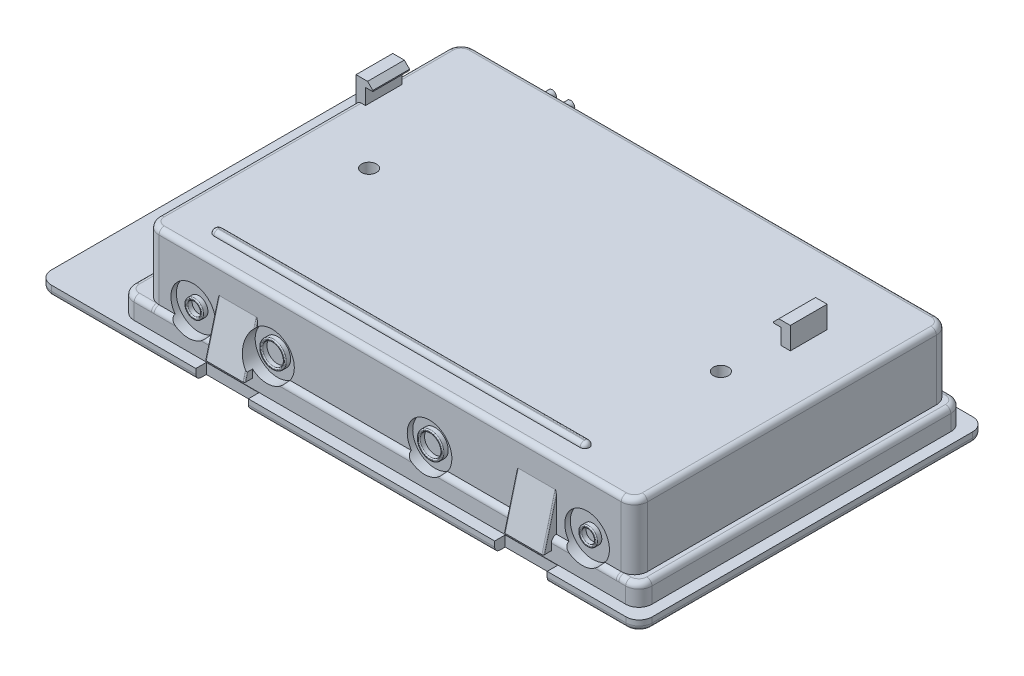
from build123d import *

# Parameters (mm, degrees)
SKETCH1_W               = 114.4
SKETCH1_H               = 66
BOSS_EXTRUDE1_DEPTH     = 2
SKETCH2_W               = 98.6
SKETCH2_H               = 61.9
BOSS_EXTRUDE2_DEPTH     = 4
SKETCH3_W               = 93
SKETCH3_H               = 60
BOSS_EXTRUDE3_DEPTH     = 12.5
FILLET1_R               = 2.5
SKETCH4_W               = 3.2
SKETCH4_H               = 7
BOSS_EXTRUDE4_DEPTH     = 4.2
LPATTERN1_COUNT         = 2
LPATTERN1_PITCH         = 79.5
FILLET2_R               = 1
CHAMFER1_SIZE           = 1
SKETCH7_W               = 1.4
SKETCH7_H               = 3
CUT_EXTRUDE1_DEPTH      = 76.074163332
BOSS_EXTRUDE5_DEPTH     = 1.25
FILLET3_R               = 1
SKETCH9_W               = 13
SKETCH9_H               = 24.5
CUT_EXTRUDE2_DEPTH      = 1
FILLET4_R               = 0.75
FILLET5_R               = 2
SKETCH10_W              = 10
SKETCH10_H              = 2
CUT_EXTRUDE3_DEPTH      = 70.829291848
BOSS_EXTRUDE7_DEPTH     = 7.5
FILLET12_R              = 0.25
LPATTERN2_COUNT         = 2
LPATTERN2_PITCH         = 56.9
FILLET12_OF_LPATTERN2_R = 0.25
SKETCH14_W              = 2.7
SKETCH14_H              = 5.65
BOSS_EXTRUDE8_DEPTH     = 2
CUT_EXTRUDE4_DEPTH      = 89.750957741
CUT_EXTRUDE4_DEPTH_BACK = 2
SKETCH11_R              = 4.25
SKETCH12_R              = 1.75
SKETCH12_R_2            = 1.25
SKETCH12_R_3            = 2.5
SKETCH12_R_4            = 2
BOSS_EXTRUDE6_DEPTH     = 1
SKETCH15_W              = 71.5
SKETCH15_H              = 1.75
BOSS_EXTRUDE9_DEPTH     = 0.8
FILLET8_RADIUS          = 0.875
FILLET8_LENGTH          = 0.8
FILLET9_RADIUS          = 0.875
FILLET9_LENGTH          = 0.8
FILLET10_R              = 0.8
CUT_EXTRUDE5_DEPTH      = 89.068893487
CUT_EXTRUDE5_DEPTH_BACK = 2
SKETCH16_R              = 4.25
SKETCH18_R              = 2.5
SKETCH18_R_2            = 2
SKETCH18_R_3            = 1.75
SKETCH18_R_4            = 1.25
BOSS_EXTRUDE10_DEPTH    = 1
FILLET11_R              = 0.2
SKETCH19_R              = 0.8
BOSS_EXTRUDE11_DEPTH    = 2.6
SKETCH20_R              = 1.425
CUT_EXTRUDE6_DEPTH      = 16.4
SKETCH21_W              = 15
SKETCH21_H              = 24.5
CUT_EXTRUDE7_DEPTH      = 0.5
FILLET13_R              = 0.25
FILLET14_R              = 0.25
BOSS_EXTRUDE12_DEPTH    = 0.5
RIB1_REACH              = 71.829
SKETCH25_WALL_W         = 147.868253574
SKETCH25_WALL_H         = 20.5


with BuildPart() as part:
    # Sketch1 → Boss-Extrude1 (new body)
    with BuildSketch(Plane(origin=(0, 0, 0), x_dir=(1, 0, 0), z_dir=(0, 1, 0))):
        Rectangle(SKETCH1_W, SKETCH1_H)
    extrude(amount=BOSS_EXTRUDE1_DEPTH)

    # Sketch2 → Boss-Extrude2 (add)
    with BuildSketch(Plane(origin=(0, 2, 0), x_dir=(1, 0, 0), z_dir=(0, 1, 0))):
        with Locations((5.8, 0)):
            Rectangle(SKETCH2_W, SKETCH2_H)
    extrude(amount=BOSS_EXTRUDE2_DEPTH)

    # Sketch3 → Boss-Extrude3 (add)
    with BuildSketch(Plane(origin=(0, 6, 0), x_dir=(1, 0, 0), z_dir=(0, 1, 0))):
        with Locations((6.8, 0)):
            Rectangle(SKETCH3_W, SKETCH3_H)
    extrude(amount=BOSS_EXTRUDE3_DEPTH)

    # Fillet1
    fillet1_edges = [part.edges().sort_by_distance(p)[0] for p in [
        (-43.5, 4, -30.95),
        (-43.5, 4, 30.95),
        (55.1, 4, 30.95),
        (55.1, 4, -30.95),
        (-39.7, 12.25, -30),
        (-39.7, 12.25, 30),
        (53.3, 12.25, 30),
        (53.3, 12.25, -30),
        (-57.2, 1, -33),
        (57.2, 1, -33),
        (57.2, 1, 33),
        (-57.2, 1, 33),
    ]]
    fillet(fillet1_edges, radius=FILLET1_R)

    # Sketch4 → Boss-Extrude4 (add)
    with BuildSketch(Plane(origin=(0, 18.5, 0), x_dir=(1, 0, 0), z_dir=(0, 1, 0))):
        with Locations((-38.1, 13.5)):
            Rectangle(SKETCH4_W, SKETCH4_H)
    boss_extrude4 = extrude(amount=BOSS_EXTRUDE4_DEPTH)

    # LPattern1: Boss-Extrude4 ×2
    with Locations(*[(i * LPATTERN1_PITCH, 0, 0) for i in range(1, LPATTERN1_COUNT)]):
        add(boss_extrude4)

    # Fillet2
    fillet2_edges = [part.edges().sort_by_distance(p)[0] for p in [
        (-42.767766953, 6, 30.217766953),
        (-43.5, 6, 0),
        (-42.767766953, 6, -30.217766953),
        (5.8, 6, -30.95),
        (54.367766953, 6, -30.217766953),
        (55.1, 6, 0),
        (54.367766953, 6, 30.217766953),
        (-38.967766953, 18.5, 29.267766953),
        (-39.7, 18.5, 8.75),
        (-39.7, 18.5, -22.25),
        (-38.967766953, 18.5, -29.267766953),
        (6.8, 18.5, -30),
        (52.567766953, 18.5, -29.267766953),
        (53.3, 18.5, 0),
        (52.567766953, 18.5, 29.267766953),
        (56.467766953, 0, -32.267766953),
        (57.2, 0, 0),
        (56.467766953, 0, 32.267766953),
        (0, 0, 33),
        (-56.467766953, 0, 32.267766953),
        (-57.2, 0, 0),
        (-56.467766953, 0, -32.267766953),
        (5.8, 6, 30.95),
        (6.8, 18.5, 30),
        (0, 0, -33),
    ]]
    fillet(fillet2_edges, radius=FILLET2_R)

    # Chamfer1
    chamfer1_edges = [part.edges().sort_by_distance(p)[0] for p in [
        (-36.5, 22.7, -13.5),
        (39.8, 22.7, -13.5),
    ]]
    chamfer(chamfer1_edges, length=CHAMFER1_SIZE)

    # Sketch7 → Cut-Extrude1 (cut, through all)
    with BuildSketch(Plane.XY.offset(-10)):
        with Locations((-37.2, 20)):
            Rectangle(SKETCH7_W, SKETCH7_H)
        with Locations((40.5, 20)):
            Rectangle(SKETCH7_W, SKETCH7_H)
    extrude(amount=-CUT_EXTRUDE1_DEPTH, mode=Mode.SUBTRACT)

    # Sketch6 → Boss-Extrude5 (add)
    with BuildSketch(Plane(origin=(0, 0, 0), x_dir=(-1, 0, 0), z_dir=(0, -1, 0))):
        with BuildLine():
            ThreePointArc((46.95, 7.6), (45.449729728, 0), (46.95, -7.6))
            Line((46.95, -7.6), (41.2, -7.6))
            Line((41.2, -7.6), (41.2, 7.6))
            Line((41.2, 7.6), (46.95, 7.6))
        make_face()
    extrude(amount=BOSS_EXTRUDE5_DEPTH)

    # Fillet3
    fillet3_edges = [part.edges().sort_by_distance(p)[0] for p in [
        (-46.95, -0.625, 7.6),
        (-46.95, -0.625, -7.6),
    ]]
    fillet(fillet3_edges, radius=FILLET3_R)

    # Sketch9 → Cut-Extrude2 (cut)
    with BuildSketch(Plane.XZ):
        with Locations((-45.1, 0)):
            Rectangle(SKETCH9_W, SKETCH9_H)
    extrude(amount=-CUT_EXTRUDE2_DEPTH, mode=Mode.SUBTRACT)


with BuildPart() as cut_extrude2_piece_1:
    # of the separate pieces the step leaves, piece 1, a body of its own (cut_extrude2_pieces)
    add(part.part.solids().sort_by_distance((54.7, 0, -32))[0])

    # Fillet4
    fillet4_edges = [cut_extrude2_piece_1.edges().sort_by_distance(p)[0] for p in [
        (-51.6, 0.5, -12.25),
        (-51.6, 0.5, 12.25),
    ]]
    fillet(fillet4_edges, radius=FILLET4_R)

    # Fillet5
    fillet5_edges = [cut_extrude2_piece_1.edges().sort_by_distance(p)[0] for p in [
        (-38.6, 0.5, -12.25),
        (-38.6, 0.5, 12.25),
    ]]
    fillet(fillet5_edges, radius=FILLET5_R)

    # Sketch10 → Cut-Extrude3 (cut, through all)
    with BuildSketch(Plane.XZ):
        with Locations((-22.2, 32)):
            Rectangle(SKETCH10_W, SKETCH10_H)
        with Locations((34.7, 32)):
            Rectangle(SKETCH10_W, SKETCH10_H)
    extrude(amount=-CUT_EXTRUDE3_DEPTH, mode=Mode.SUBTRACT)

    # Sketch13 → Boss-Extrude7 (add)
    with BuildSketch(Plane(origin=(-25.95, 0, 0), x_dir=(0, 0, -1), z_dir=(1, 0, 0))):
        Polygon((-32.5, 3.75), (-30, 13.25), (-30, 3.75), align=None)
    boss_extrude7 = extrude(amount=BOSS_EXTRUDE7_DEPTH)

    # Fillet12
    fillet12_edges = [cut_extrude2_piece_1.edges().sort_by_distance(p)[0] for p in [
        (-25.95, 8.5, 31.25),
        (-18.45, 8.5, 31.25),
    ]]
    fillet(fillet12_edges, radius=FILLET12_R)

    # LPattern2: Boss-Extrude7 ×2
    with Locations(*[(i * LPATTERN2_PITCH, 0, 0) for i in range(1, LPATTERN2_COUNT)]):
        add(boss_extrude7)

    # Fillet12 of LPattern2
    fillet12_of_lpattern2_edges = [cut_extrude2_piece_1.edges().sort_by_distance(p)[0] for p in [
        (30.95, 8.5, 31.25),
        (38.45, 8.5, 31.25),
    ]]
    fillet(fillet12_of_lpattern2_edges, radius=FILLET12_OF_LPATTERN2_R)

    # Sketch14 → Boss-Extrude8 (add)
    with BuildSketch(Plane(origin=(0, 0, -30), x_dir=(-1, 0, 0), z_dir=(0, 0, -1))):
        with Locations((-32.55, 4.825)):
            Rectangle(SKETCH14_W, SKETCH14_H)
        with Locations((17.9, 4.825)):
            Rectangle(SKETCH14_W, SKETCH14_H)
    extrude(amount=BOSS_EXTRUDE8_DEPTH)

    # Sketch11 → Cut-Extrude4 (cut, two sides: drawn at the far end of the back side and taken through both)
    with BuildSketch(Plane.XY.offset(30.95).offset(-CUT_EXTRUDE4_DEPTH_BACK)):
        with Locations(Location((-30.7, 8.5, 0), (0, 0, 216.031879072))):
            Circle(SKETCH11_R)
        with Locations(Location((-15.7, 8.5, 0), (0, 0, 225.099127844))):
            Circle(SKETCH11_R)
        with Locations(Location((14.3, 8.5, 0), (0, 0, 216.031947658))):
            Circle(SKETCH11_R)
        with Locations(Location((44.3, 8.5, 0), (0, 0, 216.031879072))):
            Circle(SKETCH11_R)
    extrude(amount=CUT_EXTRUDE4_DEPTH + CUT_EXTRUDE4_DEPTH_BACK, mode=Mode.SUBTRACT)

    # Sketch12 → Boss-Extrude6 (add)
    # profile 1 of 4: a face of its own
    with BuildSketch(Plane.XY.offset(28.95)):
        with Locations((-30.7, 8.5)):
            Circle(SKETCH12_R)
        with Locations((-30.7, 8.5)):
            Circle(SKETCH12_R_2, mode=Mode.SUBTRACT)
    # profile 2 of 4: a face of its own
    with BuildSketch(Plane.XY.offset(28.95)):
        with Locations((-15.7, 8.5)):
            Circle(SKETCH12_R_3)
        with Locations((-15.7, 8.5)):
            Circle(SKETCH12_R_4, mode=Mode.SUBTRACT)
    # profile 3 of 4: a face of its own
    with BuildSketch(Plane.XY.offset(28.95)):
        with Locations((14.3, 8.5)):
            Circle(SKETCH12_R_3)
        with Locations((14.3, 8.5)):
            Circle(SKETCH12_R_4, mode=Mode.SUBTRACT)
    # profile 4 of 4: a face of its own
    with BuildSketch(Plane.XY.offset(28.95)):
        with Locations((44.3, 8.5)):
            Circle(SKETCH12_R)
        with Locations((44.3, 8.5)):
            Circle(SKETCH12_R_2, mode=Mode.SUBTRACT)
    extrude(amount=BOSS_EXTRUDE6_DEPTH)

    # Sketch15 → Boss-Extrude9 (add)
    with BuildSketch(Plane(origin=(0, 18.5, 0), x_dir=(1, 0, 0), z_dir=(0, 1, 0))):
        with Locations((4.05, -25.075)):
            Rectangle(SKETCH15_W, SKETCH15_H)
    extrude(amount=BOSS_EXTRUDE9_DEPTH)

    # Fillet8: full round fillet: the end face becomes a half cylinder, R = half its width
    fillet8_face = Plane((-31.7, 18.9, 25.075), x_dir=(0, -1, 0), z_dir=(-1, 0, 0))  # on the end face: x along it, z out of the body
    fillet8_slab = fillet8_face.offset(-FILLET8_RADIUS / 2) * Box(FILLET8_LENGTH, 2 * FILLET8_RADIUS, FILLET8_RADIUS, mode=Mode.PRIVATE)  # the body's end, R deep
    fillet8_round = Plane((-30.825, 18.9, 25.075), x_dir=(-1, 0, 0), z_dir=(0, -1, 0)) * Cylinder(FILLET8_RADIUS, FILLET8_LENGTH, mode=Mode.PRIVATE)  # its axis R under the face
    add(fillet8_slab - fillet8_round, mode=Mode.SUBTRACT)

    # Fillet9: full round fillet: the end face becomes a half cylinder, R = half its width
    fillet9_face = Plane((39.8, 18.9, 25.075), x_dir=(0, -1, 0), z_dir=(1, 0, 0))  # on the end face: x along it, z out of the body
    fillet9_slab = fillet9_face.offset(-FILLET9_RADIUS / 2) * Box(FILLET9_LENGTH, 2 * FILLET9_RADIUS, FILLET9_RADIUS, mode=Mode.PRIVATE)  # the body's end, R deep
    fillet9_round = Plane((38.925, 18.9, 25.075), x_dir=(1, 0, 0), z_dir=(0, -1, 0)) * Cylinder(FILLET9_RADIUS, FILLET9_LENGTH, mode=Mode.PRIVATE)  # its axis R under the face
    add(fillet9_slab - fillet9_round, mode=Mode.SUBTRACT)

    # Fillet10
    fillet10_edges = [cut_extrude2_piece_1.edges().sort_by_distance(p)[0] for p in [
        (-31.443718434, 19.3, 24.456281566),
        (4.05, 19.3, 24.2),
        (39.543718434, 19.3, 24.456281566),
        (4.05, 19.3, 25.95),
    ]]
    fillet(fillet10_edges, radius=FILLET10_R - 0.0001)  # a hair under: the kernel refuses the full size

    # Sketch16 → Cut-Extrude5 (cut, two sides: drawn at the far end of the back side and taken through both)
    with BuildSketch(Plane(origin=(0, 0, -30), x_dir=(-1, 0, 0), z_dir=(0, 0, -1)).offset(-CUT_EXTRUDE5_DEPTH_BACK)):
        with Locations(Location((15.7, 8.5, 0), (0, 0, 314.900872156))):
            Circle(SKETCH16_R)
        with Locations(Location((30.7, 8.5, 0), (0, 0, 323.968120928))):
            Circle(SKETCH16_R)
        with Locations(Location((0.7, 8.5, 0), (0, 0, 216.031947658))):
            Circle(SKETCH16_R)
        with Locations(Location((-29.3, 8.5, 0), (0, 0, 191.536959033))):
            Circle(SKETCH16_R)
    extrude(amount=CUT_EXTRUDE5_DEPTH + CUT_EXTRUDE5_DEPTH_BACK, mode=Mode.SUBTRACT)

    # Sketch18 → Boss-Extrude10 (add)
    # profile 1 of 4: a face of its own
    with BuildSketch(Plane(origin=(0, 0, -28), x_dir=(-1, 0, 0), z_dir=(0, 0, -1))):
        with Locations((-29.3, 8.5)):
            Circle(SKETCH18_R)
        with Locations((-29.3, 8.5)):
            Circle(SKETCH18_R_2, mode=Mode.SUBTRACT)
    # profile 2 of 4: a face of its own
    with BuildSketch(Plane(origin=(0, 0, -28), x_dir=(-1, 0, 0), z_dir=(0, 0, -1))):
        with Locations((0.7, 8.5)):
            Circle(SKETCH18_R)
        with Locations((0.7, 8.5)):
            Circle(SKETCH18_R_2, mode=Mode.SUBTRACT)
    # profile 3 of 4: a face of its own
    with BuildSketch(Plane(origin=(0, 0, -28), x_dir=(-1, 0, 0), z_dir=(0, 0, -1))):
        with Locations((15.7, 8.5)):
            Circle(SKETCH18_R_3)
        with Locations((15.7, 8.5)):
            Circle(SKETCH18_R_4, mode=Mode.SUBTRACT)
    # profile 4 of 4: a face of its own
    with BuildSketch(Plane(origin=(0, 0, -28), x_dir=(-1, 0, 0), z_dir=(0, 0, -1))):
        with Locations(Location((30.7, 8.5, 0), (0, 0, 180))):
            Circle(SKETCH18_R_3)
        with Locations(Location((30.7, 8.5, 0), (0, 0, 180))):
            Circle(SKETCH18_R_4, mode=Mode.SUBTRACT)
    extrude(amount=BOSS_EXTRUDE10_DEPTH)

    # Fillet11
    fillet11_edges = [cut_extrude2_piece_1.edges().sort_by_distance(p)[0] for p in [
        (-32.45, 8.5, 29.95),
        (-31.95, 8.5, 29.95),
        (-18.2, 8.5, 29.95),
        (-17.7, 8.5, 29.95),
        (11.8, 8.5, 29.95),
        (12.3, 8.5, 29.95),
        (42.55, 8.5, 29.95),
        (43.05, 8.5, 29.95),
        (31.8, 8.5, -29),
        (31.3, 8.5, -29),
        (1.8, 8.5, -29),
        (1.3, 8.5, -29),
        (-13.95, 8.5, -29),
        (-14.45, 8.5, -29),
        (-32.45, 8.5, -29),
        (-31.95, 8.5, -29),
    ]]
    fillet(fillet11_edges, radius=FILLET11_R)

    # Sketch19 → Boss-Extrude11 (add)
    with BuildSketch(Plane(origin=(0, 0, -30), x_dir=(-1, 0, 0), z_dir=(0, 0, -1))):
        with Locations(Location((21.45, 15.5, 0), (0, 0, 180))):
            Circle(SKETCH19_R)
        with Locations(Location((24.95, 15.5, 0), (0, 0, 180))):
            Circle(SKETCH19_R)
    extrude(amount=BOSS_EXTRUDE11_DEPTH)

    # Sketch20 → Cut-Extrude6 (cut)
    with BuildSketch(Plane(origin=(0, 18.5, 0), x_dir=(1, 0, 0), z_dir=(0, 1, 0))):
        with Locations(Location((-27.225, 0, 0), (0, 0, 270))):
            Circle(SKETCH20_R)
        with Locations(Location((39.775, 0, 0), (0, 0, 270))):
            Circle(SKETCH20_R)
    extrude(amount=-CUT_EXTRUDE6_DEPTH, mode=Mode.SUBTRACT)

    # Sketch21 → Cut-Extrude7 (cut)
    with BuildSketch(Plane.XZ):
        with Locations((-16.1, 0)):
            Rectangle(SKETCH21_W, SKETCH21_H)
    extrude(amount=-CUT_EXTRUDE7_DEPTH, mode=Mode.SUBTRACT)

    # Fillet13
    fillet13_edges = [cut_extrude2_piece_1.edges().sort_by_distance(p)[0] for p in [
        (-23.6, 0.25, -12.25),
        (-23.6, 0.25, 12.25),
        (-8.6, 0.25, 12.25),
        (-8.6, 0.25, -12.25),
    ]]
    fillet(fillet13_edges, radius=FILLET13_R)

    # Fillet14
    fillet14_edges = [cut_extrude2_piece_1.edges().sort_by_distance(p)[0] for p in [
        (-16.1, 0.5, -12.25),
        (-23.6, 0.5, 0),
        (-8.6, 0.5, 0),
        (-16.1, 0.5, 12.25),
        (-23.526776695, 0.5, 12.176776695),
        (-8.673223305, 0.5, 12.176776695),
        (-8.673223305, 0.5, -12.176776695),
        (-23.526776695, 0.5, -12.176776695),
    ]]
    fillet(fillet14_edges, radius=FILLET14_R)

    # Sketch22 → Boss-Extrude12 (add)
    # profile 1 of 4: a face of its own
    with BuildSketch(Plane.XZ.offset(-0.5)):
        with BuildLine():
            add(Edge.make_bspline(
                [(-18.480810207, -4.710472966), (-18.369492489, -4.712414449), (-18.15405321, -4.716171907), (-17.841721091, -4.749664506), (-17.551004917, -4.803451721), (-17.281871077, -4.880190066), (-17.034289258, -4.977406923), (-16.809041837, -5.095590495), (-16.605788594, -5.234419549), (-16.424409908, -5.393335793), (-16.265467067, -5.572774988), (-16.126387081, -5.769991932), (-16.010763481, -5.987630288), (-15.914954954, -6.224172454), (-15.84286482, -6.482557879), (-15.788631104, -6.76259678), (-15.759457482, -7.06676396), (-15.755115158, -7.277197673), (-15.752869031, -7.386047414)],
                knots=[0, 0, 0, 0, 1.220094188, 2.361315121, 3.439300779, 4.45776501, 5.424701703, 6.350416049, 7.240448951, 8.117140638, 8.98716468, 9.862567629, 10.756597306, 11.683038843, 12.655042346, 13.692848548, 14.806594086, 16, 16, 16, 16], degree=3))
            Line((-15.752869031, -7.386047414), (-15.752869031, -8.502798334))
            add(Edge.make_bspline(
                [(-15.752869031, -8.502798334), (-15.756150143, -8.533773966), (-15.76292306, -8.597714292), (-15.804077977, -8.670576975), (-15.853021172, -8.72042134), (-15.90547239, -8.745278447), (-15.968220557, -8.761752593), (-16.014160864, -8.762830141), (-16.039059288, -8.763414142)],
                knots=[0, 0, 0, 0, 1.271739195, 2.625141538, 3.345887134, 4.11551627, 4.978659956, 6, 6, 6, 6], degree=3))
            Line((-16.039059288, -8.763414142), (-20.766678774, -8.763414142))
            add(Edge.make_bspline(
                [(-20.766678774, -8.763414142), (-20.791577198, -8.762830141), (-20.837517504, -8.761752593), (-20.900265671, -8.745278447), (-20.95271689, -8.72042134), (-21.001660085, -8.670576975), (-21.042815002, -8.597714292), (-21.049587919, -8.533773966), (-21.052869031, -8.502798334)],
                knots=[0, 0, 0, 0, 1.021340044, 1.88448373, 2.654112866, 3.374858462, 4.728260805, 6, 6, 6, 6], degree=3))
            Line((-21.052869031, -8.502798334), (-21.052869031, -7.309324069))
            add(Edge.make_bspline(
                [(-21.052869031, -7.309324069), (-21.051086761, -7.199612), (-21.047651402, -6.98813985), (-21.012609339, -6.684808909), (-20.959571711, -6.406996215), (-20.880994926, -6.155314639), (-20.781479177, -5.925968685), (-20.662135132, -5.717291344), (-20.523338257, -5.527573532), (-20.365106748, -5.357742723), (-20.189462949, -5.205420517), (-19.993751866, -5.075419218), (-19.782332818, -4.961875971), (-19.551938695, -4.872071342), (-19.306774153, -4.797640524), (-19.044607305, -4.748243756), (-18.767858343, -4.71500289), (-18.577934718, -4.712005694), (-18.480810207, -4.710472966)],
                knots=[0, 0, 0, 0, 1.263113269, 2.434675444, 3.512104647, 4.516227266, 5.464775124, 6.386295527, 7.279384173, 8.166048653, 9.054560378, 9.950642591, 10.866785906, 11.813164861, 12.793938232, 13.813605117, 14.881905644, 16, 16, 16, 16], degree=3))
        make_face()
        with BuildLine():
            add(Edge.make_bspline(
                [(-18.449146604, -5.489884731), (-18.518204813, -5.490924244), (-18.654575393, -5.492976992), (-18.855138914, -5.513115389), (-19.048750069, -5.544843363), (-19.234346023, -5.587733084), (-19.410670482, -5.644890122), (-19.575481807, -5.716320565), (-19.727747102, -5.803448154), (-19.866882251, -5.904841631), (-19.993628665, -6.019596054), (-20.104917898, -6.150218349), (-20.203003231, -6.294315043), (-20.285620253, -6.454658506), (-20.351163526, -6.634411049), (-20.396182869, -6.836988315), (-20.424151312, -7.062950015), (-20.427558619, -7.22155164), (-20.429339619, -7.304452745)],
                knots=[0, 0, 0, 0, 1.080645707, 2.133971976, 3.1514046, 4.150113863, 5.112591572, 6.048722402, 6.956632012, 7.852634977, 8.738669457, 9.626342803, 10.532182277, 11.461452218, 12.442398253, 13.518251219, 14.702789354, 16, 16, 16, 16], degree=3))
            Line((-20.429339619, -7.304452745), (-20.429339619, -7.984002378))
            Line((-20.429339619, -7.984002378), (-16.376398443, -7.984002378))
            Line((-16.376398443, -7.984002378), (-16.376398443, -7.295927929))
            add(Edge.make_bspline(
                [(-16.376398443, -7.295927929), (-16.377421454, -7.21871685), (-16.379387027, -7.070366576), (-16.404817615, -6.857448116), (-16.442347248, -6.663002033), (-16.497516512, -6.486489792), (-16.568871524, -6.326432789), (-16.655523186, -6.179528613), (-16.760996714, -6.047705064), (-16.882862943, -5.92990004), (-17.020526689, -5.82543251), (-17.175028686, -5.735626249), (-17.345363569, -5.658248321), (-17.533040185, -5.596923315), (-17.737026061, -5.548028308), (-17.958696077, -5.514912856), (-18.197868901, -5.493934292), (-18.363445401, -5.491265881), (-18.449146604, -5.489884731)],
                knots=[0, 0, 0, 0, 1.170923794, 2.249766071, 3.248794267, 4.172213212, 5.049054883, 5.902610501, 6.753004214, 7.602438126, 8.468504034, 9.368577322, 10.308610834, 11.302021386, 12.359784979, 13.487949637, 14.699780834, 16, 16, 16, 16], degree=3))
        make_face(mode=Mode.SUBTRACT)
    # profile 2 of 4: a face of its own
    with BuildSketch(Plane.XZ.offset(-0.5)):
        with BuildLine():
            add(Edge.make_bspline(
                [(-16.445814803, -0.034002378), (-16.424687447, -0.034109601), (-16.385644905, -0.034307744), (-16.330940442, -0.038895412), (-16.282850382, -0.041953157), (-16.241466824, -0.053231849), (-16.203803546, -0.062753495), (-16.17057744, -0.080269612), (-16.136304389, -0.103099155), (-16.108821926, -0.133287698), (-16.082676858, -0.167203573), (-16.05741593, -0.205260695), (-16.02679633, -0.254291474), (-15.977571138, -0.339042816), (-15.91343713, -0.468229526), (-15.841280172, -0.649197568), (-15.774146922, -0.860780087), (-15.720549497, -1.101362748), (-15.680423932, -1.368267743), (-15.676807084, -1.555314488), (-15.674927854, -1.65249962)],
                knots=[0, 0, 0, 0, 0.579408093, 1.070723887, 1.507478857, 1.896596424, 2.245524106, 2.569363201, 2.921653693, 3.370737716, 3.680472992, 4.097606357, 4.62309814, 5.267028883, 6.786581559, 8.576030008, 10.608993407, 12.871044045, 15.335113947, 18, 18, 18, 18], degree=3))
            add(Edge.make_bspline(
                [(-15.674927854, -1.65249962), (-15.677084861, -1.737433438), (-15.681311206, -1.903849057), (-15.71294567, -2.147589768), (-15.767931937, -2.378398118), (-15.843723404, -2.596304105), (-15.938939222, -2.800878232), (-16.059436423, -2.988163618), (-16.196480091, -3.162430079), (-16.356653283, -3.31919242), (-16.536332963, -3.459031468), (-16.735169437, -3.583887063), (-16.955734493, -3.686867677), (-17.19374889, -3.777009212), (-17.452098818, -3.845786484), (-17.729110103, -3.8949307), (-18.025031011, -3.926258417), (-18.228637305, -3.929429002), (-18.333452671, -3.931061201)],
                knots=[0, 0, 0, 0, 1.02723132, 2.012712259, 2.966727119, 3.892288129, 4.799456324, 5.689017308, 6.580135518, 7.475989912, 8.392466437, 9.329896007, 10.309474818, 11.331906404, 12.405147495, 13.537851148, 14.732499732, 16, 16, 16, 16], degree=3))
            add(Edge.make_bspline(
                [(-18.333452671, -3.931061201), (-18.441126142, -3.929139395), (-18.650506455, -3.925402277), (-18.955737063, -3.891134042), (-19.24328294, -3.839161957), (-19.512119228, -3.763270129), (-19.761854242, -3.668022861), (-19.992535885, -3.555179071), (-20.203447694, -3.424154598), (-20.394640048, -3.276611729), (-20.56432434, -3.111733186), (-20.71310832, -2.931255906), (-20.840368535, -2.735061458), (-20.946527872, -2.524095281), (-21.029552715, -2.299422246), (-21.087630366, -2.062438022), (-21.123930033, -1.813967856), (-21.128487133, -1.644101576), (-21.130810207, -1.557508812)],
                knots=[0, 0, 0, 0, 1.24951988, 2.429798713, 3.561101406, 4.638224123, 5.667439259, 6.660079071, 7.614661883, 8.545022203, 9.458144217, 10.355368421, 11.254644612, 12.167182757, 13.091592484, 14.028802, 14.995142041, 16, 16, 16, 16], degree=3))
            add(Edge.make_bspline(
                [(-21.130810207, -1.557508812), (-21.128336888, -1.480661171), (-21.123431362, -1.32824332), (-21.088451515, -1.104730076), (-21.034477915, -0.893627169), (-20.969704646, -0.696844466), (-20.891678418, -0.519438568), (-20.819196779, -0.385814841), (-20.756319269, -0.295316236), (-20.717927671, -0.237581941), (-20.680279581, -0.193582063), (-20.641446878, -0.150654404), (-20.600375654, -0.115600502), (-20.56075757, -0.08456756), (-20.525447386, -0.066826373), (-20.488114093, -0.05628015), (-20.445928666, -0.046380186), (-20.395834091, -0.039229636), (-20.336888202, -0.034169021), (-20.29417417, -0.034060954), (-20.271021604, -0.034002378)],
                knots=[0, 0, 0, 0, 2.160113017, 4.284318683, 6.343793512, 8.281922423, 10.101317623, 11.787423133, 12.543973153, 13.199413161, 13.734253049, 14.170351003, 14.825293975, 15.249889748, 15.58165888, 15.928214608, 16.337978872, 16.799614448, 17.349347202, 18, 18, 18, 18], degree=3))
            add(Edge.make_bspline(
                [(-20.271021604, -0.034002378), (-20.245841948, -0.034505898), (-20.199861512, -0.035425375), (-20.13620345, -0.040982698), (-20.083091235, -0.051893405), (-20.039549392, -0.066470009), (-20.003775728, -0.082321479), (-19.979279187, -0.105221836), (-19.964391387, -0.132756538), (-19.962611669, -0.152761294), (-19.96169256, -0.163092451)],
                knots=[0, 0, 0, 0, 1.645102313, 3.004112594, 4.169188004, 5.17555556, 6.005766438, 6.699864236, 7.328564351, 8, 8, 8, 8], degree=3))
            add(Edge.make_bspline(
                [(-19.96169256, -0.163092451), (-19.962795909, -0.173779878), (-19.965309193, -0.198124431), (-19.983396844, -0.236084647), (-20.010347554, -0.280060985), (-20.065050071, -0.34869231), (-20.142983098, -0.453004982), (-20.221681023, -0.57218074), (-20.286478069, -0.683182682), (-20.333800717, -0.779058453), (-20.379877417, -0.883423276), (-20.424048759, -0.996660432), (-20.463508716, -1.120033765), (-20.486928911, -1.256461937), (-20.505629399, -1.403956069), (-20.506717062, -1.506695078), (-20.507280796, -1.559944473)],
                knots=[0, 0, 0, 0, 0.292888416, 0.667161305, 1.136903042, 1.709192248, 3.069767855, 4.709522704, 5.622370565, 6.593324792, 7.640152672, 8.750481311, 9.92678689, 11.184577992, 12.540773171, 14, 14, 14, 14], degree=3))
            add(Edge.make_bspline(
                [(-20.507280796, -1.559944473), (-20.505843577, -1.61851759), (-20.503023121, -1.733463886), (-20.474831395, -1.90160084), (-20.431739913, -2.062132166), (-20.36904337, -2.213674558), (-20.289803488, -2.355885675), (-20.192344775, -2.487214789), (-20.078622136, -2.608056577), (-19.948528834, -2.718049462), (-19.802960267, -2.817064211), (-19.641473184, -2.903349572), (-19.465031909, -2.977231719), (-19.274417712, -3.041113139), (-19.068648867, -3.090637264), (-18.848305449, -3.125193346), (-18.614025101, -3.147856922), (-18.452855583, -3.15036161), (-18.369987597, -3.151649437)],
                knots=[0, 0, 0, 0, 0.937107526, 1.839018387, 2.722088054, 3.59359935, 4.457905938, 5.322432474, 6.205334669, 7.109187515, 8.044873762, 9.019117499, 10.035637676, 11.104490121, 12.23485763, 13.419947952, 14.673423373, 16, 16, 16, 16], degree=3))
            add(Edge.make_bspline(
                [(-18.369987597, -3.151649437), (-18.287938999, -3.150259802), (-18.128846216, -3.147565291), (-17.89738653, -3.126407988), (-17.680774351, -3.093071438), (-17.478698704, -3.04570568), (-17.292079174, -2.985021101), (-17.121183728, -2.912224785), (-16.965992362, -2.827660149), (-16.826284706, -2.731462743), (-16.70230919, -2.622413917), (-16.594469521, -2.501518996), (-16.503809548, -2.368618156), (-16.428660253, -2.224840157), (-16.371059478, -2.069970663), (-16.327370122, -1.905405294), (-16.303540171, -1.730328564), (-16.300177246, -1.610348325), (-16.298457266, -1.548983995)],
                knots=[0, 0, 0, 0, 1.326817189, 2.572707428, 3.755738064, 4.868896375, 5.925698184, 6.925726311, 7.868899626, 8.779519019, 9.663354202, 10.533005018, 11.39255994, 12.258858531, 13.150245404, 14.059538399, 15.007543856, 16, 16, 16, 16], degree=3))
            add(Edge.make_bspline(
                [(-16.298457266, -1.548983995), (-16.299477214, -1.497810762), (-16.301464066, -1.39812565), (-16.314317206, -1.253928609), (-16.337703945, -1.119638134), (-16.369537235, -0.995845534), (-16.406895446, -0.88094166), (-16.444775452, -0.774457318), (-16.48682061, -0.677099769), (-16.543172342, -0.563864613), (-16.610703024, -0.441588945), (-16.678748308, -0.334997278), (-16.725733854, -0.263802802), (-16.746934761, -0.217555039), (-16.762384627, -0.17783518), (-16.764940591, -0.152641985), (-16.766104325, -0.141171495)],
                knots=[0, 0, 0, 0, 1.426656799, 2.779117788, 4.031267967, 5.222510284, 6.339169141, 7.398863208, 8.372188574, 9.29332334, 10.924538318, 12.262097143, 12.821114311, 13.296965723, 13.679907701, 14, 14, 14, 14], degree=3))
            add(Edge.make_bspline(
                [(-16.766104325, -0.141171495), (-16.765256538, -0.132217533), (-16.763671325, -0.115475208), (-16.755317096, -0.090260483), (-16.733286199, -0.071917019), (-16.7019996, -0.057199317), (-16.658823769, -0.045225984), (-16.601423514, -0.03931513), (-16.529131353, -0.034029557), (-16.475464837, -0.03401205), (-16.445814803, -0.034002378)],
                knots=[0, 0, 0, 0, 0.581981579, 1.088202623, 1.663057629, 2.366376107, 3.320475717, 4.536401066, 6.086407837, 8, 8, 8, 8], degree=3))
        make_face()
    # profile 3 of 4: a face of its own
    with BuildSketch(Plane.XZ.offset(-0.5)):
        with BuildLine():
            add(Edge.make_bspline(
                [(-18.612335943, 4.018938799), (-18.496573596, 4.017182115), (-18.263805238, 4.013649874), (-17.915469574, 3.981186996), (-17.57167879, 3.927294775), (-17.292752455, 3.856858008), (-17.077833861, 3.785624541), (-16.921955993, 3.72369003), (-16.771602538, 3.652650552), (-16.627025348, 3.573762802), (-16.487997438, 3.486645627), (-16.359488203, 3.385880225), (-16.237493653, 3.276539699), (-16.127501095, 3.153945454), (-16.024508792, 3.022345541), (-15.936593397, 2.87639575), (-15.857845459, 2.720007404), (-15.792169737, 2.551254277), (-15.739250281, 2.369651961), (-15.702275804, 2.173919321), (-15.678470588, 1.964234074), (-15.676130779, 1.819604432), (-15.674927854, 1.745248541)],
                knots=[0, 0, 0, 0, 1.644495657, 3.30665856, 4.966087138, 6.584645389, 7.387190618, 8.181925255, 8.966294443, 9.74839117, 10.521223632, 11.294206746, 12.06591916, 12.845779464, 13.631420054, 14.43665527, 15.262088249, 16.116826241, 17.005773664, 17.945797901, 18.943909262, 20, 20, 20, 20], degree=3))
            add(Edge.make_bspline(
                [(-15.674927854, 1.745248541), (-15.675546165, 1.686735145), (-15.676764104, 1.571476192), (-15.695623581, 1.404231013), (-15.717680997, 1.247637434), (-15.746528205, 1.106577578), (-15.779109136, 0.98433973), (-15.812154415, 0.88289474), (-15.846723944, 0.804703551), (-15.882204251, 0.745844424), (-15.928308008, 0.706587443), (-15.986198972, 0.682074129), (-16.060467227, 0.669755222), (-16.115331138, 0.668292155), (-16.146228406, 0.667468211)],
                knots=[0, 0, 0, 0, 1.603942065, 3.159424922, 4.611231314, 5.941056598, 7.105098943, 8.080405844, 8.862736343, 9.449477615, 9.947040218, 10.495335576, 11.152630214, 12, 12, 12, 12], degree=3))
            add(Edge.make_bspline(
                [(-16.146228406, 0.667468211), (-16.172219637, 0.667499992), (-16.218983702, 0.667557173), (-16.281629223, 0.672512699), (-16.33026876, 0.679195637), (-16.366751827, 0.689121487), (-16.392502905, 0.704827298), (-16.409888282, 0.725133884), (-16.416479349, 0.751550424), (-16.41734242, 0.769756984), (-16.417804693, 0.779508652)],
                knots=[0, 0, 0, 0, 1.875417084, 3.374296678, 4.53043339, 5.420106258, 6.078537721, 6.682568891, 7.294367001, 8, 8, 8, 8], degree=3))
            add(Edge.make_bspline(
                [(-16.417804693, 0.779508652), (-16.416024805, 0.797515048), (-16.411760537, 0.840654889), (-16.384548604, 0.911752773), (-16.351772712, 1.002069122), (-16.31600263, 1.113917638), (-16.281142492, 1.246653993), (-16.249593914, 1.400896572), (-16.22307879, 1.575516636), (-16.221397348, 1.699666042), (-16.22051609, 1.764733836)],
                knots=[0, 0, 0, 0, 0.428268929, 1.026049494, 1.794802306, 2.715905197, 3.813007256, 5.053768874, 6.455854418, 8, 8, 8, 8], degree=3))
            add(Edge.make_bspline(
                [(-16.22051609, 1.764733836), (-16.222207125, 1.82738902), (-16.225488225, 1.948958284), (-16.255945143, 2.124145219), (-16.301781299, 2.28687554), (-16.372215525, 2.43356535), (-16.454730566, 2.568210254), (-16.55161414, 2.68977477), (-16.662358363, 2.797781431), (-16.785852058, 2.892652509), (-16.920852429, 2.975597663), (-17.065851578, 3.047679329), (-17.222007149, 3.106978744), (-17.386424979, 3.15669989), (-17.558863815, 3.194724868), (-17.735811844, 3.226201118), (-17.918272317, 3.243653856), (-18.041145326, 3.249001182), (-18.103282634, 3.251705343)],
                knots=[0, 0, 0, 0, 1.114054174, 2.1615888, 3.155958059, 4.112635765, 5.046901593, 5.9619196, 6.871273224, 7.79319541, 8.727461239, 9.687026007, 10.670443875, 11.69663601, 12.741176961, 13.811287382, 14.893160411, 16, 16, 16, 16], degree=3))
            add(Edge.make_bspline(
                [(-18.103282634, 3.251705343), (-18.082028978, 3.214647505), (-18.038449987, 3.13866325), (-17.981627541, 3.015156283), (-17.927316745, 2.88185278), (-17.875178331, 2.738359381), (-17.832667324, 2.583372949), (-17.800627473, 2.416979348), (-17.782756363, 2.239270252), (-17.780496841, 2.1171314), (-17.779339619, 2.054577586)],
                knots=[0, 0, 0, 0, 0.816352421, 1.673868008, 2.596218968, 3.568262615, 4.590617726, 5.665190137, 6.804219464, 8, 8, 8, 8], degree=3))
            add(Edge.make_bspline(
                [(-17.779339619, 2.054577586), (-17.780493166, 1.985083719), (-17.782712888, 1.851359541), (-17.806490527, 1.659450884), (-17.843035277, 1.48400025), (-17.897032326, 1.32565681), (-17.964416342, 1.184160813), (-18.041533135, 1.056536436), (-18.13072888, 0.944011428), (-18.231084822, 0.845862424), (-18.342188513, 0.762594619), (-18.462492261, 0.691148876), (-18.593126868, 0.633240864), (-18.732591674, 0.58666087), (-18.88048933, 0.553438132), (-19.035087364, 0.529218241), (-19.196600169, 0.514233729), (-19.306467041, 0.51248039), (-19.362519766, 0.511585858)],
                knots=[0, 0, 0, 0, 1.315894477, 2.532121431, 3.657415711, 4.705619122, 5.692920078, 6.621473192, 7.524679883, 8.405710272, 9.273210521, 10.14898902, 11.0508851, 11.975032774, 12.9301801, 13.91891774, 14.938257441, 16, 16, 16, 16], degree=3))
            add(Edge.make_bspline(
                [(-19.362519766, 0.511585858), (-19.421037623, 0.512603252), (-19.536783689, 0.514615619), (-19.70807929, 0.535307755), (-19.875242226, 0.566227727), (-20.03697199, 0.611471103), (-20.192555962, 0.668751394), (-20.337397559, 0.744671132), (-20.475443337, 0.830597363), (-20.60224172, 0.933207199), (-20.717230287, 1.051380224), (-20.821578929, 1.182990914), (-20.911249045, 1.331019607), (-20.99173671, 1.492147686), (-21.055423685, 1.670560505), (-21.097413801, 1.865922749), (-21.127231554, 2.076400578), (-21.129589783, 2.222522913), (-21.130810207, 2.298143762)],
                knots=[0, 0, 0, 0, 0.986952837, 1.952154692, 2.90731494, 3.852922481, 4.782895347, 5.698863367, 6.607192936, 7.522904806, 8.443216474, 9.384622013, 10.350309846, 11.358148906, 12.419743669, 13.536414685, 14.725051775, 16, 16, 16, 16], degree=3))
            add(Edge.make_bspline(
                [(-21.130810207, 2.298143762), (-21.130025063, 2.35217549), (-21.128498356, 2.457239731), (-21.11233749, 2.610361335), (-21.085925096, 2.753733904), (-21.049154829, 2.887753367), (-21.00301042, 3.012630952), (-20.946594484, 3.128532135), (-20.882181666, 3.236735245), (-20.807038802, 3.335601385), (-20.723997785, 3.427383372), (-20.632238068, 3.51171912), (-20.532125138, 3.588327183), (-20.424076593, 3.658112903), (-20.308821319, 3.721054968), (-20.185884841, 3.777478442), (-20.055582392, 3.82711173), (-19.869081731, 3.886269084), (-19.619216306, 3.944643734), (-19.300628326, 3.987071236), (-18.962752292, 4.014687516), (-18.730929907, 4.017500006), (-18.612335943, 4.018938799)],
                knots=[0, 0, 0, 0, 0.931633217, 1.811552967, 2.651977747, 3.443529685, 4.205642952, 4.944667877, 5.663926319, 6.373889455, 7.082712364, 7.796257021, 8.520270718, 9.25437053, 10.012646848, 10.78333136, 11.585617634, 12.415978489, 14.156730517, 16.002417949, 17.95494682, 20, 20, 20, 20], degree=3))
        make_face()
        with BuildLine():
            add(Edge.make_bspline(
                [(-18.667138332, 3.239527034), (-18.752809494, 3.238994502), (-18.916940565, 3.237974263), (-19.152990964, 3.225640417), (-19.368084571, 3.205820954), (-19.562726901, 3.176364211), (-19.737946397, 3.140695652), (-19.894570301, 3.095463082), (-20.03417504, 3.043575055), (-20.15680235, 2.984046633), (-20.263435747, 2.917061413), (-20.352527442, 2.84062317), (-20.428925287, 2.758872885), (-20.487265293, 2.667590036), (-20.532055498, 2.569974535), (-20.561768839, 2.464716702), (-20.582315811, 2.352933554), (-20.58424063, 2.275508496), (-20.585221972, 2.236034387)],
                knots=[0, 0, 0, 0, 1.689820446, 3.237402561, 4.661308858, 5.948975012, 7.119021134, 8.185985928, 9.161658989, 10.053407857, 10.870872374, 11.637827421, 12.363408237, 13.069732315, 13.764938249, 14.474432763, 15.222210369, 16, 16, 16, 16], degree=3))
            add(Edge.make_bspline(
                [(-20.585221972, 2.236034387), (-20.584143541, 2.195366268), (-20.582061106, 2.116836737), (-20.563569821, 2.003908649), (-20.533185991, 1.900223411), (-20.490198818, 1.805711072), (-20.436230829, 1.720223905), (-20.373370798, 1.643286742), (-20.303986677, 1.572919045), (-20.225160176, 1.512174822), (-20.139742951, 1.458715178), (-20.048598014, 1.412201093), (-19.951464643, 1.374996171), (-19.81600872, 1.331994105), (-19.637656191, 1.299056718), (-19.492560218, 1.293690261), (-19.419757818, 1.290997622)],
                knots=[0, 0, 0, 0, 1.010528091, 1.951314637, 2.83584976, 3.689501378, 4.523964651, 5.342031671, 6.155603783, 6.975287907, 7.80975118, 8.658316328, 9.51482696, 10.39265746, 12.190003548, 14, 14, 14, 14], degree=3))
            add(Edge.make_bspline(
                [(-19.419757818, 1.290997622), (-19.340864738, 1.29316101), (-19.189062113, 1.297323705), (-19.004968306, 1.328227932), (-18.870635582, 1.365571538), (-18.779293664, 1.400839071), (-18.696846025, 1.444939339), (-18.621008704, 1.495065846), (-18.553682303, 1.554208856), (-18.493707594, 1.62083934), (-18.443466363, 1.696765003), (-18.400280777, 1.780195732), (-18.366141232, 1.87340794), (-18.342186363, 1.976447985), (-18.327385232, 2.089465873), (-18.325770032, 2.168193151), (-18.324927854, 2.209242108)],
                knots=[0, 0, 0, 0, 2.020896389, 3.888520755, 4.764490757, 5.591330902, 6.391767559, 7.156383602, 7.915815748, 8.682128426, 9.446744469, 10.242366732, 11.084960099, 11.983255272, 12.948455121, 14, 14, 14, 14], degree=3))
            add(Edge.make_bspline(
                [(-18.324927854, 2.209242108), (-18.326183977, 2.257192338), (-18.328682778, 2.352579578), (-18.346207248, 2.494791491), (-18.375083314, 2.634644086), (-18.416836578, 2.770836122), (-18.467830301, 2.900648048), (-18.524219367, 3.023945685), (-18.591853915, 3.136000075), (-18.642293739, 3.205362126), (-18.667138332, 3.239527034)],
                knots=[0, 0, 0, 0, 1.04164057, 2.072132249, 3.108232139, 4.140533817, 5.162536452, 6.137046669, 7.082385427, 8, 8, 8, 8], degree=3))
        make_face(mode=Mode.SUBTRACT)
    # profile 4 of 4: a face of its own
    with BuildSketch(Plane.XZ.offset(-0.5)):
        with BuildLine():
            add(Edge.make_bspline(
                [(-15.899008737, 7.335092291), (-15.884730818, 7.329396627), (-15.85751164, 7.318538509), (-15.824716314, 7.28940057), (-15.797252871, 7.254151154), (-15.780136378, 7.206088311), (-15.764954452, 7.147174736), (-15.75808109, 7.072967896), (-15.753002594, 6.983226287), (-15.752916214, 6.917797992), (-15.752869031, 6.882059203)],
                knots=[0, 0, 0, 0, 0.719927492, 1.372457374, 2.04302017, 2.807939382, 3.755871234, 4.913204248, 6.313904687, 8, 8, 8, 8], degree=3))
            add(Edge.make_bspline(
                [(-15.752869031, 6.882059203), (-15.752566835, 6.854041028), (-15.751997338, 6.801239853), (-15.755708152, 6.727428228), (-15.756115382, 6.662988777), (-15.764278245, 6.608664366), (-15.772698737, 6.562284553), (-15.782434678, 6.523710467), (-15.792584803, 6.489992753), (-15.809295738, 6.463949182), (-15.826052529, 6.440156304), (-15.848794069, 6.423566423), (-15.874569575, 6.409789649), (-15.892855309, 6.401700726), (-15.902662229, 6.397362512)],
                knots=[0, 0, 0, 0, 1.856455016, 3.49855077, 4.89865275, 6.120098929, 7.133248244, 8.020710287, 8.760968576, 9.448499015, 10.062030721, 10.675562428, 11.289683785, 12, 12, 12, 12], degree=3))
            Line((-15.902662229, 6.397362512), (-20.781292744, 4.658300012))
            add(Edge.make_bspline(
                [(-20.781292744, 4.658300012), (-20.807853724, 4.649055394), (-20.854591039, 4.63278835), (-20.919765636, 4.620015045), (-20.973575787, 4.626900112), (-21.014795363, 4.658175985), (-21.035992385, 4.712551368), (-21.048467758, 4.785891224), (-21.050689736, 4.884045719), (-21.052086559, 4.957913471), (-21.052869031, 4.999292659)],
                knots=[0, 0, 0, 0, 1.144049848, 2.013096582, 2.683861617, 3.28512953, 4.016603515, 4.991731185, 6.314829956, 8, 8, 8, 8], degree=3))
            add(Edge.make_bspline(
                [(-21.052869031, 4.999292659), (-21.052838431, 5.033806934), (-21.052784388, 5.094762576), (-21.048018821, 5.176103945), (-21.040654784, 5.237946542), (-21.027546165, 5.285055356), (-21.007680987, 5.319017567), (-20.982480722, 5.344627027), (-20.950528046, 5.362187564), (-20.927499254, 5.372535663), (-20.915254141, 5.378038063)],
                knots=[0, 0, 0, 0, 1.895469766, 3.347588135, 4.473366247, 5.312735019, 6.012554453, 6.611705719, 7.261801497, 8, 8, 8, 8], degree=3))
            Line((-20.915254141, 5.378038063), (-16.495745869, 6.902762328))
            Line((-16.495745869, 6.902762328), (-20.906729325, 8.387298174))
            add(Edge.make_bspline(
                [(-20.906729325, 8.387298174), (-20.920131039, 8.391642004), (-20.944916225, 8.399675502), (-20.980529798, 8.413041692), (-21.007987285, 8.438523581), (-21.028356603, 8.475703639), (-21.040157319, 8.527178392), (-21.048230261, 8.594888124), (-21.052676169, 8.682774986), (-21.052799691, 8.748585777), (-21.052869031, 8.785528872)],
                knots=[0, 0, 0, 0, 0.724839396, 1.34052107, 1.930635574, 2.60263016, 3.487188534, 4.621837322, 6.103657764, 8, 8, 8, 8], degree=3))
            add(Edge.make_bspline(
                [(-21.052869031, 8.785528872), (-21.052389413, 8.823651128), (-21.051546321, 8.890663949), (-21.04637376, 8.979462101), (-21.031521931, 9.042832013), (-21.009079254, 9.089763861), (-20.966670078, 9.109723435), (-20.915416801, 9.10966147), (-20.850658265, 9.095713041), (-20.803407844, 9.078891092), (-20.776421421, 9.069283468)],
                knots=[0, 0, 0, 0, 1.670398231, 2.936292607, 3.871340322, 4.532518902, 5.112578331, 5.806369569, 6.747138342, 8, 8, 8, 8], degree=3))
            Line((-20.776421421, 9.069283468), (-15.899008737, 7.335092291))
        make_face()
    extrude(amount=BOSS_EXTRUDE12_DEPTH)

    # Sketch25 wall → Rib1 (add, up to next)
    with BuildSketch(Plane(origin=(-40.5, 9, 0), x_dir=(0.25766265056, 0.966234939601, 0), z_dir=(-0.966234939601, 0.25766265056, 0)), mode=Mode.PRIVATE) as rib1_sk1:
        Rectangle(SKETCH25_WALL_W, SKETCH25_WALL_H)
    rib1_tool1 = extrude(rib1_sk1.sketch, amount=-RIB1_REACH, mode=Mode.PRIVATE) - cut_extrude2_piece_1.part
    add(rib1_tool1.solids().sort_by_distance((-40.5, 9, 0))[0])


with BuildPart() as cut_extrude2_piece_2:
    # of the separate pieces the step leaves, piece 2, a body of its own (cut_extrude2_pieces)
    add(part.part.solids().sort_by_distance((-46.463160898, 0, -6.285714286))[0])


solid = Compound([cut_extrude2_piece_1.part, cut_extrude2_piece_2.part])
